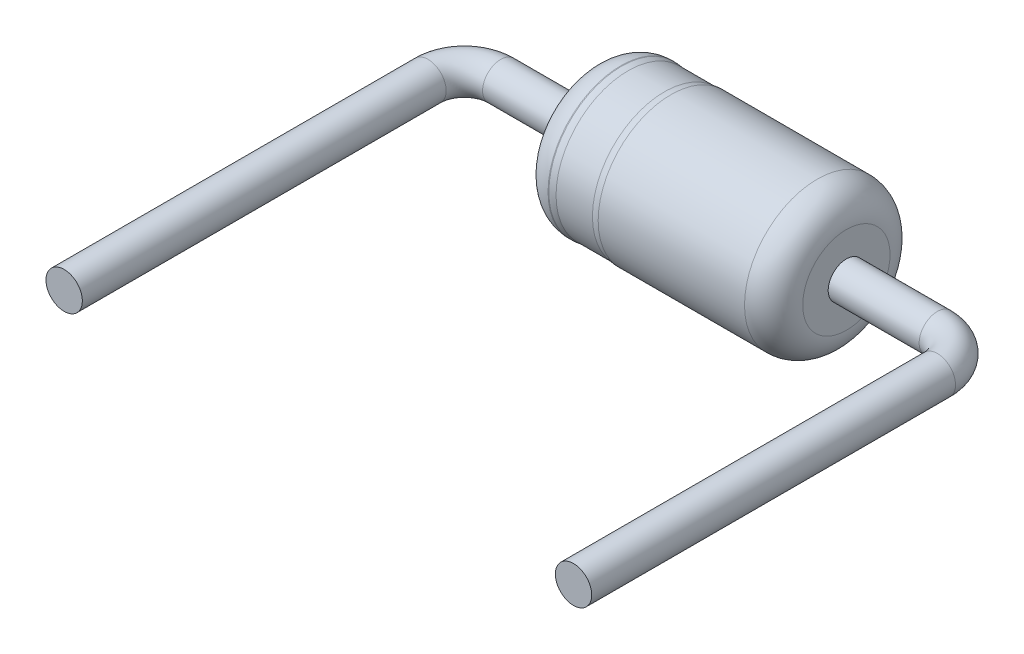
from build123d import *

# Parameters (mm, degrees)
IZIM5_R   = 0.25
IZIM7_R   = 0.25
RADYUS1_R = 0.4
RADYUS2_R = 0.4


with BuildPart() as part:
    # Çizim3 → Döndür2 (revolve)
    with BuildSketch(Plane(origin=(0, 0, 0), x_dir=(1, 0, 0), z_dir=(0, 1, 0))):
        Polygon((-0.75, -1), (1.75, -1), (1.75, 0), (-1.75, 0), (-1.75, -1), (-1.25, -1), (-1.25, -0.99), (-0.75, -0.99), align=None)
    revolve(axis=Axis((-1.75, 0, 0), (1, 0, 0)))

    # Süpür1: sweep along a path in Çizim4
    with BuildLine(Plane(origin=(0, 0, 0), x_dir=(1, 0, 0), z_dir=(0, 1, 0))) as s_p_r1_path:
        Line((-1.578677494, 0), (-3, 0))
        ThreePointArc((-3, 0), (-3.353553391, -0.146446609), (-3.5, -0.5))
        Line((-3.5, -0.5), (-3.5, -5.5))
    # Çizim5 → Süpür1 (sweep)
    with BuildSketch(Plane.ZY.offset(1.578677494)):
        Circle(IZIM5_R)
    sweep(path=s_p_r1_path.line)

    # Süpür2: sweep along a path in Çizim6
    with BuildLine(Plane(origin=(0, 0, 0), x_dir=(1, 0, 0), z_dir=(0, 1, 0))) as s_p_r2_path:
        Line((1.519396703, 0), (3, 0))
        ThreePointArc((3, 0), (3.353553391, -0.146446609), (3.5, -0.5))
        Line((3.5, -0.5), (3.5, -5.5))
    # Çizim7 → Süpür2 (sweep)
    with BuildSketch(Plane(origin=(1.519396703, 0, 0), x_dir=(0, 0, -1), z_dir=(1, 0, 0))):
        Circle(IZIM7_R)
    sweep(path=s_p_r2_path.line)

    # Radyus1
    # the kernel refuses this fillet: 0.4 mm, written as the material it takes off along each edge
    with BuildSketch(Plane(origin=(1.75, 0, 0), x_dir=(0, 0, 1), z_dir=(0, 1, 0))) as radyus1_piece_1:
        with BuildLine():
            CenterArc((1 - RADYUS1_R, -RADYUS1_R), RADYUS1_R, 0, 90)
            Line((1 - RADYUS1_R, 0), (1 - RADYUS1_R, RADYUS1_R * 0.02))
            Line((1 - RADYUS1_R, RADYUS1_R * 0.02), (1 + RADYUS1_R * 0.02, RADYUS1_R * 0.02))
            Line((1 + RADYUS1_R * 0.02, RADYUS1_R * 0.02), (1 + RADYUS1_R * 0.02, -RADYUS1_R))
            Line((1 + RADYUS1_R * 0.02, -RADYUS1_R), (1, -RADYUS1_R))
        make_face()
    revolve(axis=Axis((1.75, 0, 0), (1, 0, 0)), mode=Mode.SUBTRACT)
    with BuildSketch(Plane(origin=(-0.75, 0, 0), x_dir=(0, 0, 1), z_dir=(0, 1, 0))) as radyus1_piece_2:
        with BuildLine():
            CenterArc((0.6, 0.088881944), RADYUS1_R, 347.161431859, 12.838568141)
            Line((0.99, 0), (0.9978, -0.001777639))
            ThreePointArc((0.9978, -0.001777639), (0.995, -0.008), (1, -0.008))
            Line((1, -0.008), (1.008, 0))
            Line((1.008, 0), (1.008, 0.088881944))
            Line((1.008, 0.088881944), (1, 0.088881944))
        make_face()
    revolve(axis=Axis((-0.75, 0, 0), (1, 0, 0)), mode=Mode.SUBTRACT)

    # Radyus2
    # the kernel refuses this fillet: 0.4 mm, written as the material it takes off along each edge
    with BuildSketch(Plane(origin=(-1.25, 0, 0), x_dir=(0, 0, 1), z_dir=(0, 1, 0))) as radyus2_piece_1:
        with BuildLine():
            CenterArc((0.6, -0.088881944), RADYUS2_R, 0, 12.838568141)
            Line((1, -0.088881944), (1.008, -0.088881944))
            Line((1.008, -0.088881944), (1.008, 0))
            Line((1.008, 0), (1, 0.008))
            ThreePointArc((1, 0.008), (0.995, 0.008), (0.9978, 0.001777639))
            Line((0.9978, 0.001777639), (0.99, 0))
        make_face()
    revolve(axis=Axis((-1.25, 0, 0), (1, 0, 0)), mode=Mode.SUBTRACT)
    with BuildSketch(Plane(origin=(-1.75, 0, 0), x_dir=(0, 0, 1), z_dir=(0, 1, 0))) as radyus2_piece_2:
        with BuildLine():
            CenterArc((1 - RADYUS2_R, RADYUS2_R), RADYUS2_R, 270, 90)
            Line((1 - RADYUS2_R, 0), (1 - RADYUS2_R, -RADYUS2_R * 0.02))
            Line((1 - RADYUS2_R, -RADYUS2_R * 0.02), (1 + RADYUS2_R * 0.02, -RADYUS2_R * 0.02))
            Line((1 + RADYUS2_R * 0.02, -RADYUS2_R * 0.02), (1 + RADYUS2_R * 0.02, RADYUS2_R))
            Line((1 + RADYUS2_R * 0.02, RADYUS2_R), (1, RADYUS2_R))
        make_face()
    revolve(axis=Axis((-1.75, 0, 0), (1, 0, 0)), mode=Mode.SUBTRACT)


solid = part.part
